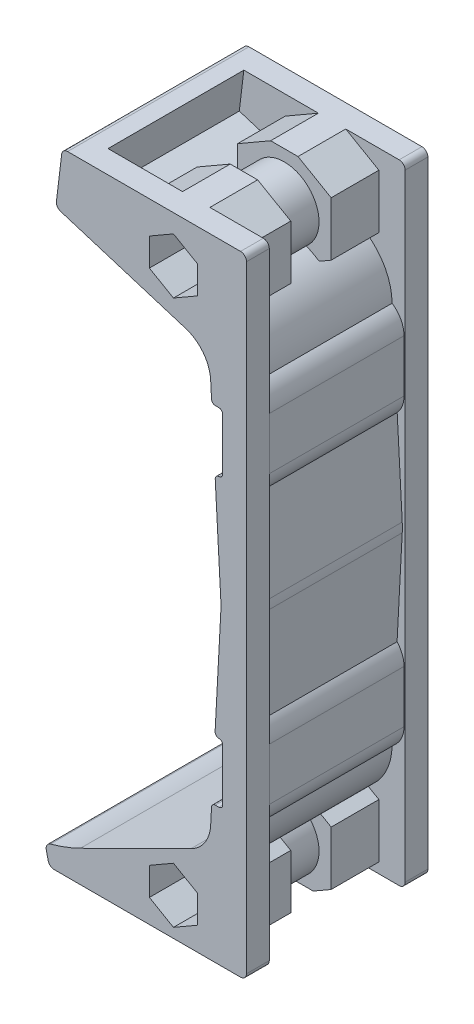
from build123d import *

# Parameters (mm, degrees)
BOSS_EXTRUDE1_DEPTH     = 24.13
CUT_EXTRUDE1_DEPTH      = 138.766550514
CUT_EXTRUDE1_DEPTH_BACK = 138.766550514
FILLET1_R               = 1.5875
CUT_EXTRUDE2_DEPTH      = 12.7
CUT_EXTRUDE3_DEPTH      = 138.766550514
CUT_EXTRUDE3_DEPTH_BACK = 138.766550514
SKETCH4_R               = 3.175
SHELL1_START            = -18.073116
SHELL1_DEPTH            = 36.146232
SHELL1_START_2          = -5.373116
SHELL1_2_DEPTH          = 10.746232


# Read off the part's stored shape, not the designer's step: Shell1
with BuildPart() as part:
    # Sketch1 → Boss-Extrude1 (new, symmetric)
    with BuildSketch(Plane.XY):
        with BuildLine():
            Line((56.161313585, 65.087564001), (56.15, 65.087371974))
            ThreePointArc((56.15, 65.087371974), (55.438759683, 64.766920639), (55.174115771, 64.033084522))
            Line((55.174115771, 64.033084522), (56.680450554, 36.457041128))
            ThreePointArc((56.680450554, 36.457041128), (56.705496383, 35.550244887), (56.681639728, 34.643416582))
            Line((56.681639728, 34.643416582), (55.144848554, 5.815734008))
            ThreePointArc((55.144848554, 5.815734008), (55.417746823, 5.074471658), (56.143430652, 4.7625))
            Line((56.143430652, 4.7625), (56.149999968, 4.762499984))
            ThreePointArc((56.149999968, 4.762499984), (56.857106771, 4.469606766), (57.15, 3.762499968))
            Line((57.15, 3.762499968), (57.15, -10.112499968))
            ThreePointArc((57.15, -10.112499968), (56.857106771, -10.819606766), (56.149999968, -11.112499984))
            Line((56.149999968, -11.112499984), (55.190522202, -11.1125))
            ThreePointArc((55.190522202, -11.1125), (54.502493828, -11.386816202), (54.191940103, -12.059266056))
            Line((54.191940103, -12.059266056), (53.961494186, -16.382053603))
            ThreePointArc((53.961494186, -16.382053603), (52.407837698, -21.109352316), (48.682296217, -24.408070592))
            Line((48.682296217, -24.408070592), (19.327486058, -38.967689038))
            ThreePointArc((19.327486058, -38.967689038), (0, -43.4975), (-19.327486058, -38.967689038))
            Line((-19.327486058, -38.967689038), (-19.327486058, -47.388950103))
            Line((-19.327486058, -47.388950103), (63.5, -47.388950103))
            Line((63.5, -47.388950103), (63.5, 119.854559949))
            Line((63.5, 119.854559949), (-4.702524006, 119.854559949))
            Line((-4.702524006, 119.854559949), (-4.702524006, 108.02491605))
            ThreePointArc((-4.702524006, 108.02491605), (0, 108.7374), (4.702524006, 108.02491605))
            Line((4.702524006, 108.02491605), (47.271514403, 94.82250963))
            ThreePointArc((47.271514403, 94.82250963), (51.961130003, 91.582350175), (53.960821068, 86.244526329))
            Line((53.960821068, 86.244526329), (54.197705155, 81.907956584))
            ThreePointArc((54.197705155, 81.907956584), (54.508664182, 81.236365226), (55.196216585, 80.9625))
            Line((55.196216585, 80.9625), (56.149999984, 80.962499984))
            ThreePointArc((56.149999984, 80.962499984), (56.857106777, 80.669606761), (57.15, 79.962499968))
            Line((57.15, 79.962499968), (57.15, 66.087500032))
            ThreePointArc((57.15, 66.087500032), (56.8610955, 65.384404568), (56.161313585, 65.087564001))
        make_face()
    extrude(amount=BOSS_EXTRUDE1_DEPTH, both=True)

    # Sketch2 → Cut-Extrude1 (cut, two sides: drawn at the far end of the back side and taken through both)
    with BuildSketch(Plane.XY.offset(-CUT_EXTRUDE1_DEPTH_BACK)):
        Polygon((0, 0), (16.649604997, 137.747881839), (-33.336773011, 132.313158031), (-32.126746787, -67.704176811), (15.765326083, -67.704176811), align=None)
    extrude(amount=CUT_EXTRUDE1_DEPTH + CUT_EXTRUDE1_DEPTH_BACK, mode=Mode.SUBTRACT)

    # Fillet1
    fillet1_edges = [part.edges().sort_by_distance(p)[0] for p in [
        (63.5, 119.854559949, 0),
        (63.5, -47.388950103, 0),
        (11.034802966, -47.388950103, 0),
        (9.864742858, -42.364128158, 0),
        (12.755119811, 105.527472687, 0),
        (14.486836775, 119.854559949, 0),
    ]]
    fillet(fillet1_edges, radius=FILLET1_R)

    # Sketch3 → Cut-Extrude2 (cut)
    with BuildSketch(Plane(origin=(0, 0, -24.13), x_dir=(-1, 0, 0), z_dir=(0, 0, -1))):
        Polygon((-44.059380862, -30.050777043), (-50.460180862, -33.746280646), (-50.460180862, -41.137287852), (-44.059380862, -44.832791455), (-37.658580862, -41.137287852), (-37.658580862, -33.746280646), align=None)
        Polygon((-37.658580862, 111.2671939), (-44.059380862, 114.962697503), (-50.460180862, 111.2671939), (-50.460180862, 103.876186694), (-44.059380862, 100.180683091), (-37.658580862, 103.876186694), align=None)
    cut_extrude2 = extrude(amount=-CUT_EXTRUDE2_DEPTH, mode=Mode.SUBTRACT)

    # Mirror1: Cut-Extrude2 across plane
    add(cut_extrude2.mirror(Plane.XY), mode=Mode.SUBTRACT)

    # Sketch4 → Cut-Extrude3 (cut, two sides: drawn at the far end of the back side and taken through both)
    with BuildSketch(Plane.XY.offset(-CUT_EXTRUDE3_DEPTH_BACK)):
        with Locations((44.059380862, 107.571690297)):
            Circle(SKETCH4_R)
        with Locations((44.059380862, -37.441784249)):
            Circle(SKETCH4_R)
    extrude(amount=CUT_EXTRUDE3_DEPTH + CUT_EXTRUDE3_DEPTH_BACK, mode=Mode.SUBTRACT)

    # Shell1 outline → Shell1 (cut)
    with BuildSketch(Plane.XY.offset(SHELL1_START)):
        with BuildLine():
            ThreePointArc((60.031332227, -16.006129752), (58.284234513, -23.045011467), (53.540141007, -28.530609249))
            Line((53.540141007, -28.530609249), (56.517064862, -30.249337038))
            Line((56.517064862, -30.249337038), (56.517064862, -44.63423146))
            Line((56.517064862, -44.63423146), (51.745752212, -47.388950103))
            Line((51.745752212, -47.388950103), (61.9125, -47.388950103))
            ThreePointArc((61.9125, -47.388950103), (63.035032015, -46.923982118), (63.5, -45.801450103))
            Line((63.5, -45.801450103), (63.5, 118.267059949))
            ThreePointArc((63.5, 118.267059949), (63.035032015, 119.389591964), (61.9125, 119.854559949))
            Line((61.9125, 119.854559949), (47.700194563, 119.854559949))
            Line((47.700194563, 119.854559949), (56.517064862, 114.764137508))
            Line((56.517064862, 114.764137508), (56.517064862, 100.379243086))
            Line((56.517064862, 100.379243086), (53.321926303, 98.534528979))
            ThreePointArc((53.321926303, 98.534528979), (58.222287934, 93.013291574), (60.031332227, 85.856129752))
            ThreePointArc((60.031332227, 85.856129752), (62.362476281, 83.309849707), (63.206884, 79.962499968))
            Line((63.206884, 79.962499968), (63.206884008, 66.087500032))
            ThreePointArc((63.206884008, 66.087500032), (62.736011515, 63.552926254), (61.386232226, 61.356592716))
            Line((61.386232226, 61.356592716), (62.728318266, 36.787404457))
            ThreePointArc((62.728318266, 36.787404457), (62.762379081, 35.55421632), (62.729935471, 34.320984576))
            Line((62.729935471, 34.320984576), (61.354914269, 8.527841436))
            ThreePointArc((61.354914269, 8.527841436), (62.727616894, 6.318780038), (63.206884, 3.762499968))
            Line((63.206884, 3.762499968), (63.206884, -10.112499968))
            ThreePointArc((63.206884, -10.112499968), (62.362476281, -13.459849707), (60.031332227, -16.006129752))
        make_face()
        with BuildLine():
            Line((31.601696862, -44.63423146), (31.601696862, -39.640802436))
            Line((31.601696862, -39.640802436), (22.018775007, -44.39381174))
            ThreePointArc((22.018775007, -44.39381174), (19.565089882, -45.528499114), (17.053178169, -46.527691625))
            Line((17.053178169, -46.527691625), (17.253727402, -47.388950103))
            Line((17.253727402, -47.388950103), (36.373009512, -47.388950103))
            Line((36.373009512, -47.388950103), (31.601696862, -44.63423146))
        make_face()
        Polygon((31.601696862, 114.764137508), (40.418567161, 119.854559949), (20.587804641, 119.854559949), (19.374447508, 109.816041015), (31.601696862, 106.023864741), align=None)
    extrude(amount=SHELL1_DEPTH, mode=Mode.SUBTRACT)

    # Shell1 2 outline → Shell1 2 (cut)
    with BuildSketch(Plane.XY.offset(SHELL1_START_2)):
        with BuildLine():
            ThreePointArc((53.540141007, -28.530609249), (52.483348575, -29.226420137), (51.373585166, -29.834193295))
            Line((51.373585166, -29.834193295), (50.103961944, -30.463910523))
            ThreePointArc((50.103961944, -30.463910523), (48.161435217, -45.712263816), (34.846350755, -38.031494714))
            Line((34.846350755, -38.031494714), (31.601696862, -39.640802436))
            Line((31.601696862, -39.640802436), (31.601696862, -44.63423146))
            Line((31.601696862, -44.63423146), (36.373009512, -47.388950103))
            Line((36.373009512, -47.388950103), (51.745752212, -47.388950103))
            Line((51.745752212, -47.388950103), (56.517064862, -44.63423146))
            Line((56.517064862, -44.63423146), (56.517064862, -30.249337038))
            Line((56.517064862, -30.249337038), (53.540141007, -28.530609249))
        make_face()
        with BuildLine():
            Line((56.517064862, 114.764137508), (47.700194563, 119.854559949))
            Line((47.700194563, 119.854559949), (40.418567161, 119.854559949))
            Line((40.418567161, 119.854559949), (31.601696862, 114.764137508))
            Line((31.601696862, 114.764137508), (31.601696862, 106.023864741))
            Line((31.601696862, 106.023864741), (35.222242894, 104.900983514))
            ThreePointArc((35.222242894, 104.900983514), (46.805661297, 116.385635269), (49.81545048, 100.353979805))
            ThreePointArc((49.81545048, 100.353979805), (51.626581689, 99.555827316), (53.321926303, 98.534528979))
            Line((53.321926303, 98.534528979), (56.517064862, 100.379243086))
            Line((56.517064862, 100.379243086), (56.517064862, 114.764137508))
        make_face()
    extrude(amount=SHELL1_2_DEPTH, mode=Mode.SUBTRACT)


solid = part.part
